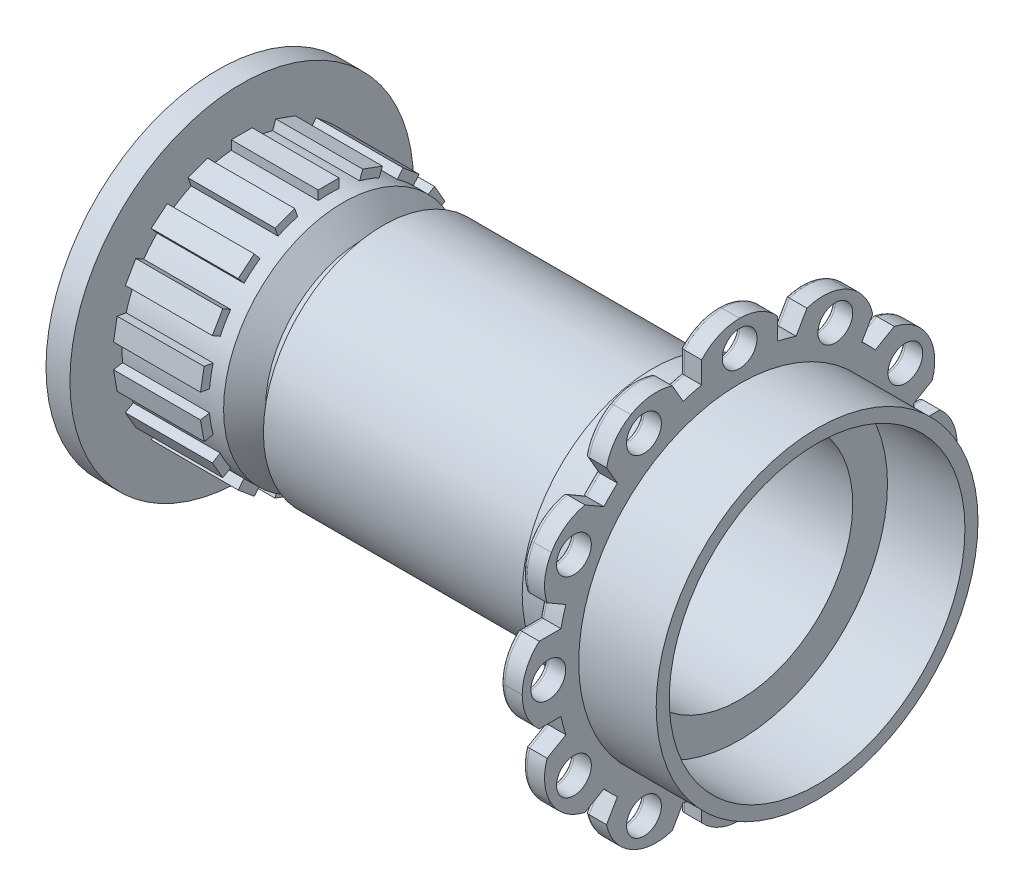
from build123d import *

# Parameters (mm, degrees)
BOSS_EXTRUDE1_DEPTH = 5
SKETCH3_R           = 4
CUT_EXTRUDE2_DEPTH  = 5
CIRPATTERN1_COUNT   = 12
FILLET1_R           = 1
SKETCH5_R           = 37
SKETCH5_R_2         = 34
BOSS_EXTRUDE2_DEPTH = 17.81
CHAMFER1_SIZE       = 11
SKETCH7_W           = 4.8
SKETCH7_H           = 3.5
BOSS_EXTRUDE3_DEPTH = 20
CIRPATTERN2_COUNT   = 18
CUT_EXTRUDE3_START  = -48.5
SKETCH8_W           = 2.4
SKETCH8_H           = 2.4
CUT_EXTRUDE3_DEPTH  = 68.5
CIRPATTERN3_COUNT   = 15


with BuildPart() as part:
    # Sketch1 → Revolve1 (revolve)
    with BuildSketch(Plane.XY, mode=Mode.PRIVATE) as revolve1_sk:
        Polygon((-5, 0), (-5, 30), (-20, 30), (-20, 27.5), (-82.01, 27.5), (-82.01, 22.25), (-86.76, 22.25), (-91.165273064, 27.5), (-106.165273064, 27.5), (-114.5, 27.5), (-114.5, 0), align=None)
    revolve(revolve1_sk.sketch.rotate(Axis((-114.5, 0, 0), (1, 0, 0)), 90), axis=Axis((-114.5, 0, 0), (1, 0, 0)))

    # Sketch2 → Boss-Extrude1 (add)
    with BuildSketch(Plane(origin=(-5, 0, 0), x_dir=(0, 0, -1), z_dir=(1, 0, 0))):
        with BuildLine():
            Line((-8.732291014, 41.082199231), (-8.732291014, 46.082199231))
            ThreePointArc((-8.732291014, 46.082199231), (-4.785467999, 48.975717337), (0, 50))
            ThreePointArc((0, 50), (4.785467999, 48.975717337), (8.732291014, 46.082199231))
            Line((8.732291014, 46.082199231), (8.732291014, 41.082199231))
            ThreePointArc((8.732291014, 41.082199231), (10.870399894, 40.568884704), (12.978713764, 39.944373684))
            Line((12.978713764, 39.944373684), (15.478713764, 44.274500703))
            ThreePointArc((15.478713764, 44.274500703), (20.343521812, 44.806949382), (25, 43.301270189))
            ThreePointArc((25, 43.301270189), (28.632195525, 40.021481383), (30.603485467, 35.542209689))
            Line((30.603485467, 35.542209689), (28.103485467, 31.21208267))
            ThreePointArc((28.103485467, 31.21208267), (29.69848481, 29.69848481), (31.21208267, 28.103485467))
            Line((31.21208267, 28.103485467), (35.542209689, 30.603485467))
            ThreePointArc((35.542209689, 30.603485467), (40.021481383, 28.632195525), (43.301270189, 25))
            ThreePointArc((43.301270189, 25), (44.806949382, 20.343521812), (44.274500703, 15.478713764))
            Line((44.274500703, 15.478713764), (39.944373684, 12.978713764))
            ThreePointArc((39.944373684, 12.978713764), (40.568884704, 10.870399894), (41.082199231, 8.732291014))
            Line((41.082199231, 8.732291014), (46.082199231, 8.732291014))
            ThreePointArc((46.082199231, 8.732291014), (48.975717337, 4.785467999), (50, 0))
            ThreePointArc((50, 0), (48.975717337, -4.785467999), (46.082199231, -8.732291014))
            Line((46.082199231, -8.732291014), (41.082199231, -8.732291014))
            ThreePointArc((41.082199231, -8.732291014), (40.568884704, -10.870399894), (39.944373684, -12.978713764))
            Line((39.944373684, -12.978713764), (44.274500703, -15.478713764))
            ThreePointArc((44.274500703, -15.478713764), (44.806949382, -20.343521812), (43.301270189, -25))
            ThreePointArc((43.301270189, -25), (40.021481383, -28.632195525), (35.542209689, -30.603485467))
            Line((35.542209689, -30.603485467), (31.21208267, -28.103485467))
            ThreePointArc((31.21208267, -28.103485467), (29.69848481, -29.69848481), (28.103485467, -31.21208267))
            Line((28.103485467, -31.21208267), (30.603485467, -35.542209689))
            ThreePointArc((30.603485467, -35.542209689), (28.632195525, -40.021481383), (25, -43.301270189))
            ThreePointArc((25, -43.301270189), (20.343521812, -44.806949382), (15.478713764, -44.274500703))
            Line((15.478713764, -44.274500703), (12.978713764, -39.944373684))
            ThreePointArc((12.978713764, -39.944373684), (10.870399894, -40.568884704), (8.732291014, -41.082199231))
            Line((8.732291014, -41.082199231), (8.732291014, -46.082199231))
            ThreePointArc((8.732291014, -46.082199231), (4.785467999, -48.975717337), (0, -50))
            ThreePointArc((0, -50), (-4.785467999, -48.975717337), (-8.732291014, -46.082199231))
            Line((-8.732291014, -46.082199231), (-8.732291014, -41.082199231))
            ThreePointArc((-8.732291014, -41.082199231), (-10.870399894, -40.568884704), (-12.978713764, -39.944373684))
            Line((-12.978713764, -39.944373684), (-15.478713764, -44.274500703))
            ThreePointArc((-15.478713764, -44.274500703), (-20.343521812, -44.806949382), (-25, -43.301270189))
            ThreePointArc((-25, -43.301270189), (-28.632195525, -40.021481383), (-30.603485467, -35.542209689))
            Line((-30.603485467, -35.542209689), (-28.103485467, -31.21208267))
            ThreePointArc((-28.103485467, -31.21208267), (-29.69848481, -29.69848481), (-31.21208267, -28.103485467))
            Line((-31.21208267, -28.103485467), (-35.542209689, -30.603485467))
            ThreePointArc((-35.542209689, -30.603485467), (-40.021481383, -28.632195525), (-43.301270189, -25))
            ThreePointArc((-43.301270189, -25), (-44.806949382, -20.343521812), (-44.274500703, -15.478713764))
            Line((-44.274500703, -15.478713764), (-39.944373684, -12.978713764))
            ThreePointArc((-39.944373684, -12.978713764), (-40.568884704, -10.870399894), (-41.082199231, -8.732291014))
            Line((-41.082199231, -8.732291014), (-46.082199231, -8.732291014))
            ThreePointArc((-46.082199231, -8.732291014), (-48.975717337, -4.785467999), (-50, 0))
            ThreePointArc((-50, 0), (-48.975717337, 4.785467999), (-46.082199231, 8.732291014))
            Line((-46.082199231, 8.732291014), (-41.082199231, 8.732291014))
            ThreePointArc((-41.082199231, 8.732291014), (-40.568884704, 10.870399894), (-39.944373684, 12.978713764))
            Line((-39.944373684, 12.978713764), (-44.274500703, 15.478713764))
            ThreePointArc((-44.274500703, 15.478713764), (-44.806949382, 20.343521812), (-43.301270189, 25))
            ThreePointArc((-43.301270189, 25), (-40.021481383, 28.632195525), (-35.542209689, 30.603485467))
            Line((-35.542209689, 30.603485467), (-31.21208267, 28.103485467))
            ThreePointArc((-31.21208267, 28.103485467), (-29.69848481, 29.69848481), (-28.103485467, 31.21208267))
            Line((-28.103485467, 31.21208267), (-30.603485467, 35.542209689))
            ThreePointArc((-30.603485467, 35.542209689), (-28.632195525, 40.021481383), (-25, 43.301270189))
            ThreePointArc((-25, 43.301270189), (-20.343521812, 44.806949382), (-15.478713764, 44.274500703))
            Line((-15.478713764, 44.274500703), (-12.978713764, 39.944373684))
            ThreePointArc((-12.978713764, 39.944373684), (-10.870399894, 40.568884704), (-8.732291014, 41.082199231))
        make_face()
    extrude(amount=BOSS_EXTRUDE1_DEPTH)

    # Sketch3 → Cut-Extrude2 (cut)
    with BuildSketch(Plane(origin=(0, 0, 0), x_dir=(0, 0, -1), z_dir=(1, 0, 0))):
        with Locations((0, 44)):
            Circle(SKETCH3_R)
    cut_extrude2 = extrude(amount=-CUT_EXTRUDE2_DEPTH, mode=Mode.SUBTRACT)

    # CirPattern1: Cut-Extrude2 ×12 about axis
    cirpattern1_axis = Axis((0, 0, 0), (1, 0, 0))
    for i in range(1, CIRPATTERN1_COUNT):
        add(cut_extrude2.rotate(cirpattern1_axis, i * 360 / CIRPATTERN1_COUNT), mode=Mode.SUBTRACT)

    # Fillet1
    fillet1_edges = [part.edges().sort_by_distance(p)[0] for p in [
        (-5, 44, 4),
        (-5, 25.464101615, -36.105117767),
        (-5, 4, -44),
        (-5, -18.535898385, -40.105117767),
        (-5, -36.105117767, -25.464101615),
        (-5, -44, -4),
        (-5, -40.105117767, 18.535898385),
        (-5, -25.464101615, 36.105117767),
        (-5, -4, 44),
        (-5, 18.535898385, 40.105117767),
        (-5, 36.105117767, 25.464101615),
        (-5, 40.105117767, -18.535898385),
        (-5, 40.568884704, 10.870399894),
        (-5, 42.109437194, 14.228713764),
        (-5, 44.806949382, 20.343521812),
        (-5, 40.021481383, 28.632195525),
        (-5, 33.37714618, 29.353485467),
        (-5, 29.69848481, 29.69848481),
        (-5, 29.353485467, 33.37714618),
        (-5, 28.632195525, 40.021481383),
        (-5, 20.343521812, 44.806949382),
        (-5, 14.228713764, 42.109437194),
        (-5, 10.870399894, 40.568884704),
        (-5, 8.732291014, 43.582199231),
        (-5, 4.785467999, 48.975717337),
        (-5, -4.785467999, 48.975717337),
        (-5, -8.732291014, 43.582199231),
        (-5, -10.870399894, 40.568884704),
        (-5, -14.228713764, 42.109437194),
        (-5, -20.343521812, 44.806949382),
        (-5, -28.632195525, 40.021481383),
        (-5, -29.353485467, 33.37714618),
        (-5, -29.69848481, 29.69848481),
        (-5, -33.37714618, 29.353485467),
        (-5, -40.021481383, 28.632195525),
        (-5, -44.806949382, 20.343521812),
        (-5, -42.109437194, 14.228713764),
        (-5, -40.568884704, 10.870399894),
        (-5, -43.582199231, 8.732291014),
        (-5, -48.975717337, 4.785467999),
        (-5, -48.975717337, -4.785467999),
        (-5, -43.582199231, -8.732291014),
        (-5, -40.568884704, -10.870399894),
        (-5, -42.109437194, -14.228713764),
        (-5, -44.806949382, -20.343521812),
        (-5, -40.021481383, -28.632195525),
        (-5, -33.37714618, -29.353485467),
        (-5, -29.69848481, -29.69848481),
        (-5, -29.353485467, -33.37714618),
        (-5, -28.632195525, -40.021481383),
        (-5, -20.343521812, -44.806949382),
        (-5, -14.228713764, -42.109437194),
        (-5, -10.870399894, -40.568884704),
        (-5, -8.732291014, -43.582199231),
        (-5, -4.785467999, -48.975717337),
        (-5, 4.785467999, -48.975717337),
        (-5, 8.732291014, -43.582199231),
        (-5, 10.870399894, -40.568884704),
        (-5, 14.228713764, -42.109437194),
        (-5, 20.343521812, -44.806949382),
        (-5, 28.632195525, -40.021481383),
        (-5, 29.353485467, -33.37714618),
        (-5, 29.69848481, -29.69848481),
        (-5, 33.37714618, -29.353485467),
        (-5, 40.021481383, -28.632195525),
        (-5, 44.806949382, -20.343521812),
        (-5, 42.109437194, -14.228713764),
        (-5, 40.568884704, -10.870399894),
        (-5, 43.582199231, -8.732291014),
        (-5, 48.975717337, -4.785467999),
        (-5, 48.975717337, 4.785467999),
        (-5, 43.582199231, 8.732291014),
        (-5, 0, -30),
    ]]
    fillet(fillet1_edges, radius=FILLET1_R - 0.0001)  # a hair under: the kernel refuses the full size

    # Sketch5 → Boss-Extrude2 (add)
    with BuildSketch(Plane(origin=(0, 0, 0), x_dir=(0, 0, -1), z_dir=(1, 0, 0))):
        Circle(SKETCH5_R)
        Circle(SKETCH5_R_2, mode=Mode.SUBTRACT)
    extrude(amount=BOSS_EXTRUDE2_DEPTH)

    # Sketch6 → Cut-Revolve2 (revolve, cut)
    with BuildSketch(Plane.XY, mode=Mode.PRIVATE) as cut_revolve2_sk:
        Polygon((0, 0), (0, 26), (-63, 26), (-63, 14), (-111.5, 14), (-111.5, 20), (-114.5, 20), (-114.5, 0), align=None)
    revolve(cut_revolve2_sk.sketch.rotate(Axis((-114.5, 0, 0), (1, 0, 0)), 180), axis=Axis((-114.5, 0, 0), (1, 0, 0)), mode=Mode.SUBTRACT)

    # Chamfer1
    chamfer1_edges = [part.edges().sort_by_distance(p)[0] for p in [
        (-63, 26, 0),
    ]]
    chamfer(chamfer1_edges, length=CHAMFER1_SIZE)

    # Sketch7 → Boss-Extrude3 (add)
    with BuildSketch(Plane.ZY.offset(114.5)):
        with Locations((0, 27.75)):
            Rectangle(SKETCH7_W, SKETCH7_H)
    boss_extrude3 = extrude(amount=-BOSS_EXTRUDE3_DEPTH)

    # CirPattern2: Boss-Extrude3 ×18 about axis
    cirpattern2_axis = Axis((0, 0, 0), (1, 0, 0))
    for i in range(1, CIRPATTERN2_COUNT):
        add(boss_extrude3.rotate(cirpattern2_axis, i * 360 / CIRPATTERN2_COUNT))

    # Sketch8 → Cut-Extrude3 (cut)
    with BuildSketch(Plane.ZY.offset(111.5).offset(CUT_EXTRUDE3_START)):
        with Locations((0, 14.2)):
            Rectangle(SKETCH8_W, SKETCH8_H)
    cut_extrude3 = extrude(amount=CUT_EXTRUDE3_DEPTH, mode=Mode.SUBTRACT)

    # CirPattern3: Cut-Extrude3 ×15 about axis
    cirpattern3_axis = Axis((0, 0, 0), (1, 0, 0))
    for i in range(1, CIRPATTERN3_COUNT):
        add(cut_extrude3.rotate(cirpattern3_axis, i * 360 / CIRPATTERN3_COUNT), mode=Mode.SUBTRACT)

    # Sketch10 → Revolve3 (revolve)
    with BuildSketch(Plane.XY, mode=Mode.PRIVATE) as revolve3_sk:
        Polygon((-114.5, 29.5), (-114.5, 39.5), (-120, 39.5), (-120, 20), (-114.5, 20), align=None)
    revolve(revolve3_sk.sketch.rotate(Axis((0, 0, 0), (-1, 0, 0)), 90), axis=Axis((0, 0, 0), (-1, 0, 0)))


solid = part.part
